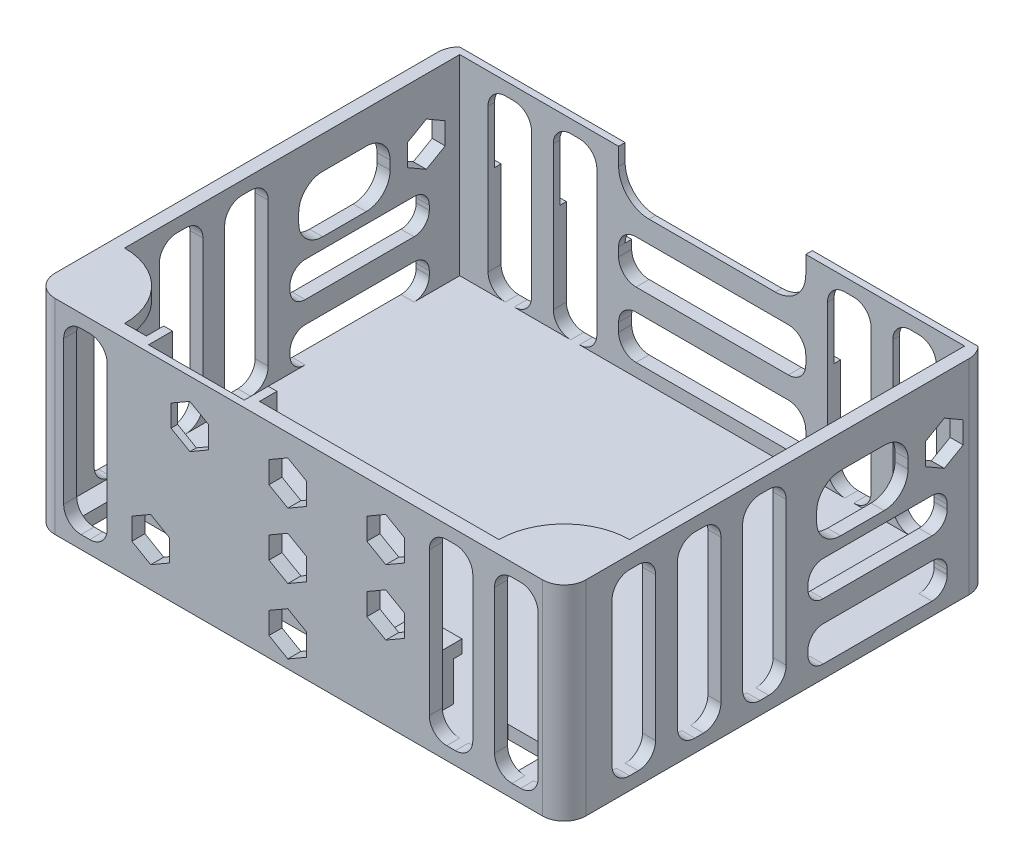
from build123d import *

# Parameters (mm, degrees)
SKETCH1_W                = 61
SKETCH1_H                = 49
BOSS_EXTRUDE1_DEPTH      = 23.5
SKETCH2_W                = 58
SKETCH2_H                = 46
CUT_EXTRUDE1_DEPTH       = 22
SKETCH3_W                = 16
SKETCH3_H                = 3
SKETCH3_W_2              = 5.2
SKETCH3_H_2              = 4.15
SKETCH3_W_3              = 12
SKETCH3_H_3              = 5
CUT_EXTRUDE2_DEPTH       = 1.5
SKETCH4_W                = 21.5
SKETCH4_H                = 1.5
CUT_EXTRUDE3_DEPTH       = 5.5
SKETCH5_W                = 10.5
SKETCH5_H                = 6.5
CUT_EXTRUDE6_DEPTH       = 61
SKETCH8_W                = 5
SKETCH8_H                = 3
BOSS_EXTRUDE2_DEPTH      = 6
SKETCH9_W                = 5
SKETCH9_H                = 1.5
BOSS_EXTRUDE3_DEPTH      = 1
SKETCH10_W               = 11
SKETCH10_H               = 11
CUT_EXTRUDE8_DEPTH       = 0.75
BOSS_EXTRUDE4_DEPTH      = 2
SKETCH12_W               = 7.5
SKETCH12_H               = 7.5
BOSS_EXTRUDE5_DEPTH      = 1.5
FILLET1_R                = 2.75
FILLET2_R                = 2.75
FILLET3_R                = 2.75
FILLET4_R                = 2.75
FILLET5_R                = 3.5
FILLET6_R                = 3.5
FILLET7_R                = 7.5
FILLET8_R                = 7.5
FILLET9_R                = 2.5
FILLET10_R               = 2.5
FILLET11_R               = 2.5
FILLET12_R               = 2.5
CUT_EXTRUDE10_DEPTH      = 61
FILLET13_R               = 2.75
FILLET14_R               = 2.75
FILLET15_R               = 2.75
FILLET16_R               = 2.75
CUT_EXTRUDE11_DEPTH      = 61
CUT_EXTRUDE12_DEPTH      = 1.5
CUT_EXTRUDE14_DEPTH      = 61
CUT_EXTRUDE15_DEPTH      = 1.5
CUT_EXTRUDE18_DEPTH      = 1.5
CUT_EXTRUDE18_DEPTH_BACK = 1.5
CUT_EXTRUDE19_DEPTH      = 1.5
SKETCH25_W               = 61
SKETCH25_H               = 10
CUT_EXTRUDE20_DEPTH      = 0.75


with BuildPart() as part:
    # Sketch1 → Boss-Extrude1 (new body)
    with BuildSketch(Plane(origin=(0, 0, 0), x_dir=(1, 0, 0), z_dir=(0, 1, 0))):
        with Locations((-50.798701292, -19.282823978)):
            Rectangle(SKETCH1_W, SKETCH1_H)
    extrude(amount=BOSS_EXTRUDE1_DEPTH)

    # Sketch2 → Cut-Extrude1 (cut)
    with BuildSketch(Plane(origin=(0, 23.5, 0), x_dir=(1, 0, 0), z_dir=(0, 1, 0))):
        with Locations((-50.798701292, -19.282823978)):
            Rectangle(SKETCH2_W, SKETCH2_H)
    extrude(amount=-CUT_EXTRUDE1_DEPTH, mode=Mode.SUBTRACT)

    # Sketch3 → Cut-Extrude2 (cut)
    with BuildSketch(Plane(origin=(0, 1.5, 0), x_dir=(1, 0, 0), z_dir=(0, 1, 0))):
        with Locations((-50.538701292, -40.782823978)):
            Rectangle(SKETCH3_W, SKETCH3_H)
        with Locations((-29.798701292, -40.207823978)):
            Rectangle(SKETCH3_W_2, SKETCH3_H_2)
        with Locations((-71.538701292, -39.782823978)):
            Rectangle(SKETCH3_W_3, SKETCH3_H_3)
    extrude(amount=-CUT_EXTRUDE2_DEPTH, mode=Mode.SUBTRACT)

    # Sketch4 → Cut-Extrude3 (cut)
    with BuildSketch(Plane(origin=(0, 23.5, 0), x_dir=(1, 0, 0), z_dir=(0, 1, 0))):
        with Locations((-50.798701292, 4.467176022)):
            Rectangle(SKETCH4_W, SKETCH4_H)
    extrude(amount=-CUT_EXTRUDE3_DEPTH, mode=Mode.SUBTRACT)

    # Sketch5 → Cut-Extrude6 (cut)
    with BuildSketch(Plane.ZY.offset(81.298701292)):
        with Locations((9.532823978, 16.5)):
            Rectangle(SKETCH5_W, SKETCH5_H)
    extrude(amount=-CUT_EXTRUDE6_DEPTH, mode=Mode.SUBTRACT)

    # Sketch8 → Boss-Extrude2 (add)
    with BuildSketch(Plane(origin=(0, 1.5, 0), x_dir=(1, 0, 0), z_dir=(0, 1, 0))):
        with Locations((-40.038701292, -40.782823978)):
            Rectangle(SKETCH8_W, SKETCH8_H)
        with Locations((-61.038701292, -40.782823978)):
            Rectangle(SKETCH8_W, SKETCH8_H)
    extrude(amount=BOSS_EXTRUDE2_DEPTH)

    # Sketch9 → Boss-Extrude3 (add)
    with BuildSketch(Plane(origin=(0, 0, 39.282823978), x_dir=(-1, 0, 0), z_dir=(0, 0, -1))):
        with Locations((40.038701292, 6.75)):
            Rectangle(SKETCH9_W, SKETCH9_H)
        with Locations((61.038701292, 6.75)):
            Rectangle(SKETCH9_W, SKETCH9_H)
    extrude(amount=BOSS_EXTRUDE3_DEPTH)

    # Sketch10 → Cut-Extrude8 (cut)
    with BuildSketch(Plane(origin=(0, 0, 42.282823978), x_dir=(-1, 0, 0), z_dir=(0, 0, -1))):
        with Locations((63.298701292, 18)):
            Rectangle(SKETCH10_W, SKETCH10_H)
    extrude(amount=-CUT_EXTRUDE8_DEPTH, mode=Mode.SUBTRACT)

    # Sketch11 → Boss-Extrude4 (add)
    with BuildSketch(Plane(origin=(0, 0, 42.282823978), x_dir=(-1, 0, 0), z_dir=(0, 0, -1))):
        Polygon((57.798701292, 12.5), (57.798701292, 23.5), (56.798701292, 23.5), (56.798701292, 11.5), (69.798701292, 11.5), (69.798701292, 23.5), (68.798701292, 23.5), (68.798701292, 12.5), align=None)
    extrude(amount=BOSS_EXTRUDE4_DEPTH)

    # Sketch12 → Boss-Extrude5 (add)
    with BuildSketch(Plane(origin=(0, 23.5, 0), x_dir=(1, 0, 0), z_dir=(0, 1, 0))):
        with Locations((-25.548701292, -38.532823978)):
            Rectangle(SKETCH12_W, SKETCH12_H)
        with Locations((-76.048701292, -38.532823978)):
            Rectangle(SKETCH12_W, SKETCH12_H)
    extrude(amount=-BOSS_EXTRUDE5_DEPTH)

    # Fillet1
    fillet1_edges = [part.edges().sort_by_distance(p)[0] for p in [
        (-80.548701292, 13.25, 14.782823978),
    ]]
    fillet(fillet1_edges, radius=FILLET1_R)

    # Fillet2
    fillet2_edges = [part.edges().sort_by_distance(p)[0] for p in [
        (-80.548701292, 19.75, 14.782823978),
    ]]
    fillet(fillet2_edges, radius=FILLET2_R)

    # Fillet3
    fillet3_edges = [part.edges().sort_by_distance(p)[0] for p in [
        (-80.548701292, 19.75, 4.282823978),
    ]]
    fillet(fillet3_edges, radius=FILLET3_R)

    # Fillet4
    fillet4_edges = [part.edges().sort_by_distance(p)[0] for p in [
        (-80.548701292, 13.25, 4.282823978),
    ]]
    fillet(fillet4_edges, radius=FILLET4_R)

    # Fillet5
    fillet5_edges = [part.edges().sort_by_distance(p)[0] for p in [
        (-40.048701292, 18, -4.467176022),
    ]]
    fillet(fillet5_edges, radius=FILLET5_R)

    # Fillet6
    fillet6_edges = [part.edges().sort_by_distance(p)[0] for p in [
        (-61.548701292, 18, -4.467176022),
    ]]
    fillet(fillet6_edges, radius=FILLET6_R)

    # Fillet7
    fillet7_edges = [part.edges().sort_by_distance(p)[0] for p in [
        (-29.298701292, 22.75, 34.782823978),
    ]]
    fillet(fillet7_edges, radius=FILLET7_R - 0.0001)  # a hair under: the kernel refuses the full size

    # Fillet8
    fillet8_edges = [part.edges().sort_by_distance(p)[0] for p in [
        (-72.298701292, 22.75, 34.782823978),
    ]]
    fillet(fillet8_edges, radius=FILLET8_R - 0.0001)  # a hair under: the kernel refuses the full size

    # Fillet9
    fillet9_edges = [part.edges().sort_by_distance(p)[0] for p in [
        (-20.298701292, 11.75, -5.217176022),
    ]]
    fillet(fillet9_edges, radius=FILLET9_R)

    # Fillet10
    fillet10_edges = [part.edges().sort_by_distance(p)[0] for p in [
        (-81.298701292, 11.75, -5.217176022),
    ]]
    fillet(fillet10_edges, radius=FILLET10_R)

    # Fillet11
    fillet11_edges = [part.edges().sort_by_distance(p)[0] for p in [
        (-81.298701292, 11.75, 43.782823978),
    ]]
    fillet(fillet11_edges, radius=FILLET11_R)

    # Fillet12
    fillet12_edges = [part.edges().sort_by_distance(p)[0] for p in [
        (-20.298701292, 11.75, 43.782823978),
    ]]
    fillet(fillet12_edges, radius=FILLET12_R)

    # Sketch13 → Cut-Extrude10 (cut)
    with BuildSketch(Plane(origin=(-20.298701292, 0, 0), x_dir=(0, 0, -1), z_dir=(1, 0, 0))):
        with BuildLine():
            Line((-36.282823978, 22), (-35.282823978, 22))
            ThreePointArc((-35.282823978, 22), (-33.868610415, 21.414213562), (-33.282823978, 20))
            Line((-33.282823978, 20), (-33.282823978, 3.5))
            ThreePointArc((-33.282823978, 3.5), (-33.868610415, 2.085786438), (-35.282823978, 1.5))
            Line((-35.282823978, 1.5), (-36.282823978, 1.5))
            ThreePointArc((-36.282823978, 1.5), (-37.69703754, 2.085786438), (-38.282823978, 3.5))
            Line((-38.282823978, 3.5), (-38.282823978, 20))
            ThreePointArc((-38.282823978, 20), (-37.69703754, 21.414213562), (-36.282823978, 22))
        make_face()
        with BuildLine():
            Line((-28.782823978, 22), (-27.782823978, 22))
            ThreePointArc((-27.782823978, 22), (-26.368610415, 21.414213562), (-25.782823978, 20))
            Line((-25.782823978, 20), (-25.782823978, 3.5))
            ThreePointArc((-25.782823978, 3.5), (-26.368610415, 2.085786438), (-27.782823978, 1.5))
            Line((-27.782823978, 1.5), (-28.782823978, 1.5))
            ThreePointArc((-28.782823978, 1.5), (-30.19703754, 2.085786438), (-30.782823978, 3.5))
            Line((-30.782823978, 3.5), (-30.782823978, 20))
            ThreePointArc((-30.782823978, 20), (-30.19703754, 21.414213562), (-28.782823978, 22))
        make_face()
        with BuildLine():
            Line((-21.282823978, 22), (-20.282823978, 22))
            ThreePointArc((-20.282823978, 22), (-18.868610415, 21.414213562), (-18.282823978, 20))
            Line((-18.282823978, 20), (-18.282823978, 3.5))
            ThreePointArc((-18.282823978, 3.5), (-18.868610415, 2.085786438), (-20.282823978, 1.5))
            Line((-20.282823978, 1.5), (-21.282823978, 1.5))
            ThreePointArc((-21.282823978, 1.5), (-22.69703754, 2.085786438), (-23.282823978, 3.5))
            Line((-23.282823978, 3.5), (-23.282823978, 20))
            ThreePointArc((-23.282823978, 20), (-22.69703754, 21.414213562), (-21.282823978, 22))
        make_face()
    extrude(amount=-CUT_EXTRUDE10_DEPTH, mode=Mode.SUBTRACT)

    # Fillet13
    fillet13_edges = [part.edges().sort_by_distance(p)[0] for p in [
        (-21.048701292, 13.25, 14.782823978),
    ]]
    fillet(fillet13_edges, radius=FILLET13_R)

    # Fillet14
    fillet14_edges = [part.edges().sort_by_distance(p)[0] for p in [
        (-21.048701292, 19.75, 14.782823978),
    ]]
    fillet(fillet14_edges, radius=FILLET14_R)

    # Fillet15
    fillet15_edges = [part.edges().sort_by_distance(p)[0] for p in [
        (-21.048701292, 13.25, 4.282823978),
    ]]
    fillet(fillet15_edges, radius=FILLET15_R)

    # Fillet16
    fillet16_edges = [part.edges().sort_by_distance(p)[0] for p in [
        (-21.048701292, 19.75, 4.282823978),
    ]]
    fillet(fillet16_edges, radius=FILLET16_R)

    # Sketch16 → Cut-Extrude11 (cut)
    with BuildSketch(Plane(origin=(-20.298701292, 0, 0), x_dir=(0, 0, -1), z_dir=(1, 0, 0))):
        Polygon((-0.117760468, 19), (-2.282823978, 17.75), (-2.282823978, 15.25), (-0.117760468, 14), (2.047303041, 15.25), (2.047303041, 17.75), align=None)
    extrude(amount=-CUT_EXTRUDE11_DEPTH, mode=Mode.SUBTRACT)

    # Sketch19 → Cut-Extrude12 (cut)
    with BuildSketch(Plane(origin=(0, 0, -5.217176022), x_dir=(-1, 0, 0), z_dir=(0, 0, -1))):
        with BuildLine():
            Line((66.048701292, 22), (67.048701292, 22))
            ThreePointArc((67.048701292, 22), (68.462914854, 21.414213562), (69.048701292, 20))
            Line((69.048701292, 20), (69.048701292, 3.5))
            ThreePointArc((69.048701292, 3.5), (68.462914854, 2.085786438), (67.048701292, 1.5))
            Line((67.048701292, 1.5), (66.048701292, 1.5))
            ThreePointArc((66.048701292, 1.5), (64.634487729, 2.085786438), (64.048701292, 3.5))
            Line((64.048701292, 3.5), (64.048701292, 20))
            ThreePointArc((64.048701292, 20), (64.634487729, 21.414213562), (66.048701292, 22))
        make_face()
        with BuildLine():
            Line((73.548701292, 22), (74.548701292, 22))
            ThreePointArc((74.548701292, 22), (75.962914854, 21.414213562), (76.548701292, 20))
            Line((76.548701292, 20), (76.548701292, 3.5))
            ThreePointArc((76.548701292, 3.5), (75.962914854, 2.085786438), (74.548701292, 1.5))
            Line((74.548701292, 1.5), (73.548701292, 1.5))
            ThreePointArc((73.548701292, 1.5), (72.134487729, 2.085786438), (71.548701292, 3.5))
            Line((71.548701292, 3.5), (71.548701292, 20))
            ThreePointArc((71.548701292, 20), (72.134487729, 21.414213562), (73.548701292, 22))
        make_face()
        with BuildLine():
            Line((27.048701292, 22), (28.048701292, 22))
            ThreePointArc((28.048701292, 22), (29.462914854, 21.414213562), (30.048701292, 20))
            Line((30.048701292, 20), (30.048701292, 3.5))
            ThreePointArc((30.048701292, 3.5), (29.462914854, 2.085786438), (28.048701292, 1.5))
            Line((28.048701292, 1.5), (27.048701292, 1.5))
            ThreePointArc((27.048701292, 1.5), (25.634487729, 2.085786438), (25.048701292, 3.5))
            Line((25.048701292, 3.5), (25.048701292, 20))
            ThreePointArc((25.048701292, 20), (25.634487729, 21.414213562), (27.048701292, 22))
        make_face()
        with BuildLine():
            Line((34.548701292, 22), (35.548701292, 22))
            ThreePointArc((35.548701292, 22), (36.962914854, 21.414213562), (37.548701292, 20))
            Line((37.548701292, 20), (37.548701292, 3.5))
            ThreePointArc((37.548701292, 3.5), (36.962914854, 2.085786438), (35.548701292, 1.5))
            Line((35.548701292, 1.5), (34.548701292, 1.5))
            ThreePointArc((34.548701292, 1.5), (33.134487729, 2.085786438), (32.548701292, 3.5))
            Line((32.548701292, 3.5), (32.548701292, 20))
            ThreePointArc((32.548701292, 20), (33.134487729, 21.414213562), (34.548701292, 22))
        make_face()
        with BuildLine():
            Line((42.048701292, 15.5), (59.548701292, 15.5))
            ThreePointArc((59.548701292, 15.5), (60.962914854, 14.914213562), (61.548701292, 13.5))
            Line((61.548701292, 13.5), (61.548701292, 12.5))
            ThreePointArc((61.548701292, 12.5), (60.962914854, 11.085786438), (59.548701292, 10.5))
            Line((59.548701292, 10.5), (42.048701292, 10.5))
            ThreePointArc((42.048701292, 10.5), (40.634487729, 11.085786438), (40.048701292, 12.5))
            Line((40.048701292, 12.5), (40.048701292, 13.5))
            ThreePointArc((40.048701292, 13.5), (40.634487729, 14.914213562), (42.048701292, 15.5))
        make_face()
        with BuildLine():
            Line((42.048701292, 8), (59.548701292, 8))
            ThreePointArc((59.548701292, 8), (60.962914854, 7.414213562), (61.548701292, 6))
            Line((61.548701292, 6), (61.548701292, 5))
            ThreePointArc((61.548701292, 5), (60.962914854, 3.585786438), (59.548701292, 3))
            Line((59.548701292, 3), (42.048701292, 3))
            ThreePointArc((42.048701292, 3), (40.634487729, 3.585786438), (40.048701292, 5))
            Line((40.048701292, 5), (40.048701292, 6))
            ThreePointArc((40.048701292, 6), (40.634487729, 7.414213562), (42.048701292, 8))
        make_face()
    extrude(amount=-CUT_EXTRUDE12_DEPTH, mode=Mode.SUBTRACT)

    # Sketch20 → Cut-Extrude14 (cut)
    with BuildSketch(Plane(origin=(-20.298701292, 0, 0), x_dir=(0, 0, -1), z_dir=(1, 0, 0))):
        with BuildLine():
            Line((-1.532823978, 1.5), (-14.032823978, 1.5))
            ThreePointArc((-14.032823978, 1.5), (-15.270260845, 2.012563133), (-15.782823978, 3.25))
            Line((-15.782823978, 3.25), (-15.782823978, 3.75))
            ThreePointArc((-15.782823978, 3.75), (-15.270260845, 4.987436867), (-14.032823978, 5.5))
            Line((-14.032823978, 5.5), (-1.532823978, 5.5))
            ThreePointArc((-1.532823978, 5.5), (-0.295387111, 4.987436867), (0.217176022, 3.75))
            Line((0.217176022, 3.75), (0.217176022, 3.25))
            ThreePointArc((0.217176022, 3.25), (-0.295387111, 2.012563133), (-1.532823978, 1.5))
        make_face()
        with BuildLine():
            Line((-1.532823978, 8), (-14.032823978, 8))
            ThreePointArc((-14.032823978, 8), (-15.270260845, 8.512563133), (-15.782823978, 9.75))
            Line((-15.782823978, 9.75), (-15.782823978, 10.25))
            ThreePointArc((-15.782823978, 10.25), (-15.270260845, 11.487436867), (-14.032823978, 12))
            Line((-14.032823978, 12), (-1.532823978, 12))
            ThreePointArc((-1.532823978, 12), (-0.295387111, 11.487436867), (0.217176022, 10.25))
            Line((0.217176022, 10.25), (0.217176022, 9.75))
            ThreePointArc((0.217176022, 9.75), (-0.295387111, 8.512563133), (-1.532823978, 8))
        make_face()
    extrude(amount=-CUT_EXTRUDE14_DEPTH, mode=Mode.SUBTRACT)

    # Sketch22 → Cut-Extrude15 (cut)
    with BuildSketch(Plane(origin=(0, 0, 42.282823978), x_dir=(-1, 0, 0), z_dir=(0, 0, -1))):
        with BuildLine():
            Line((75.798701292, 22), (74.798701292, 22))
            ThreePointArc((74.798701292, 22), (73.384487729, 21.414213562), (72.798701292, 20))
            Line((72.798701292, 20), (72.798701292, 3.5))
            ThreePointArc((72.798701292, 3.5), (73.384487729, 2.085786438), (74.798701292, 1.5))
            Line((74.798701292, 1.5), (75.798701292, 1.5))
            ThreePointArc((75.798701292, 1.5), (77.212914854, 2.085786438), (77.798701292, 3.5))
            Line((77.798701292, 3.5), (77.798701292, 20))
            ThreePointArc((77.798701292, 20), (77.212914854, 21.414213562), (75.798701292, 22))
        make_face()
        with BuildLine():
            Line((26.298701292, 22), (25.298701292, 22))
            ThreePointArc((25.298701292, 22), (23.884487729, 21.414213562), (23.298701292, 20))
            Line((23.298701292, 20), (23.298701292, 3.5))
            ThreePointArc((23.298701292, 3.5), (23.884487729, 2.085786438), (25.298701292, 1.5))
            Line((25.298701292, 1.5), (26.298701292, 1.5))
            ThreePointArc((26.298701292, 1.5), (27.712914854, 2.085786438), (28.298701292, 3.5))
            Line((28.298701292, 3.5), (28.298701292, 20))
            ThreePointArc((28.298701292, 20), (27.712914854, 21.414213562), (26.298701292, 22))
        make_face()
        with BuildLine():
            Line((33.798701292, 22), (32.798701292, 22))
            ThreePointArc((32.798701292, 22), (31.384487729, 21.414213562), (30.798701292, 20))
            Line((30.798701292, 20), (30.798701292, 3.5))
            ThreePointArc((30.798701292, 3.5), (31.384487729, 2.085786438), (32.798701292, 1.5))
            Line((32.798701292, 1.5), (33.798701292, 1.5))
            ThreePointArc((33.798701292, 1.5), (35.212914854, 2.085786438), (35.798701292, 3.5))
            Line((35.798701292, 3.5), (35.798701292, 20))
            ThreePointArc((35.798701292, 20), (35.212914854, 21.414213562), (33.798701292, 22))
        make_face()
    extrude(amount=-CUT_EXTRUDE15_DEPTH, mode=Mode.SUBTRACT)

    # Sketch23 → Cut-Extrude18 (cut, two sides: drawn at the far end of the back side and taken through both)
    with BuildSketch(Plane(origin=(0, 0, 43.032823978), x_dir=(-1, 0, 0), z_dir=(0, 0, -1)).offset(-CUT_EXTRUDE18_DEPTH_BACK)):
        Polygon((40.798701292, 16), (42.963764801, 17.25), (42.963764801, 19.75), (40.798701292, 21), (38.633637782, 19.75), (38.633637782, 17.25), align=None)
        Polygon((52.048701292, 16), (54.213764801, 17.25), (54.213764801, 19.75), (52.048701292, 21), (49.883637782, 19.75), (49.883637782, 17.25), align=None)
        Polygon((63.298701292, 16), (65.463764801, 17.25), (65.463764801, 19.75), (63.298701292, 21), (61.133637782, 19.75), (61.133637782, 17.25), align=None)
        Polygon((52.048701292, 8.5), (54.213764801, 9.75), (54.213764801, 12.25), (52.048701292, 13.5), (49.883637782, 12.25), (49.883637782, 9.75), align=None)
        Polygon((52.048701292, 1), (54.213764801, 2.25), (54.213764801, 4.75), (52.048701292, 6), (49.883637782, 4.75), (49.883637782, 2.25), align=None)
        Polygon((40.798701292, 8.5), (42.963764801, 9.75), (42.963764801, 12.25), (40.798701292, 13.5), (38.633637782, 12.25), (38.633637782, 9.75), align=None)
    extrude(amount=CUT_EXTRUDE18_DEPTH + CUT_EXTRUDE18_DEPTH_BACK, mode=Mode.SUBTRACT)

    # Sketch24 → Cut-Extrude19 (cut)
    with BuildSketch(Plane(origin=(0, 0, 42.282823978), x_dir=(-1, 0, 0), z_dir=(0, 0, -1))):
        Polygon((67.798701292, 7.5), (65.633637782, 6.25), (65.633637782, 3.75), (67.798701292, 2.5), (69.963764801, 3.75), (69.963764801, 6.25), align=None)
    extrude(amount=-CUT_EXTRUDE19_DEPTH, mode=Mode.SUBTRACT)

    # Sketch25 → Cut-Extrude20 (cut)
    with BuildSketch(Plane(origin=(0, 0, -5.217176022), x_dir=(-1, 0, 0), z_dir=(0, 0, -1))):
        with Locations((50.798701292, 18.5)):
            Rectangle(SKETCH25_W, SKETCH25_H)
    extrude(amount=-CUT_EXTRUDE20_DEPTH, mode=Mode.SUBTRACT)


solid = part.part
